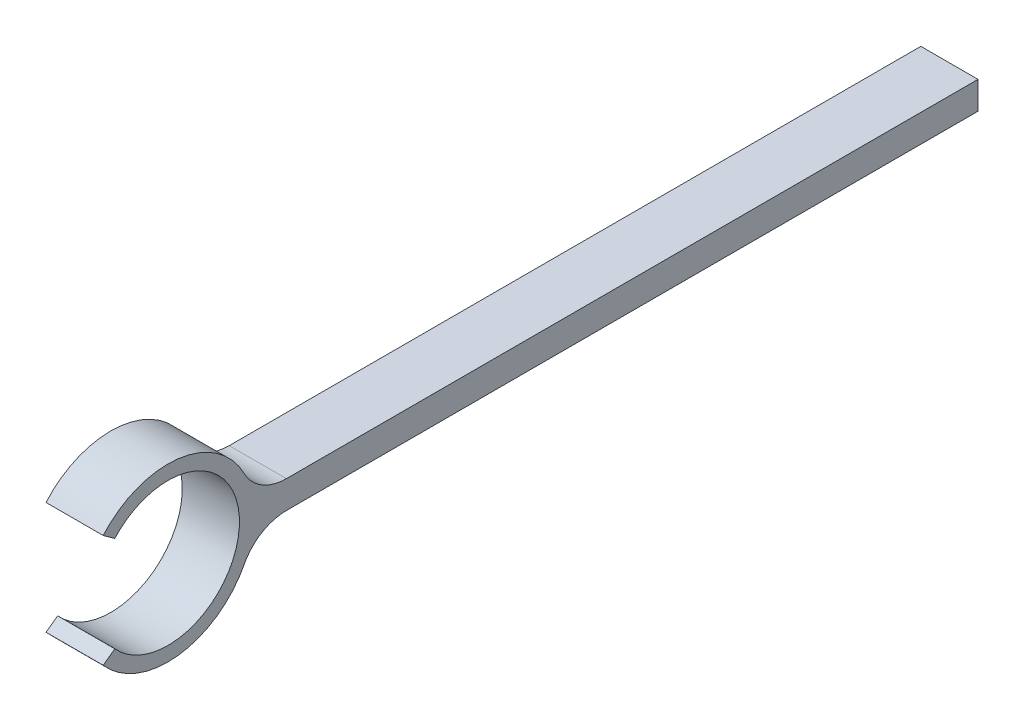
from build123d import *

# Parameters (mm, degrees)
BOSS_EXTRUDE1_DEPTH = 6
FILLET1_R           = 5


with BuildPart() as part:
    # Sketch1 → Boss-Extrude1 (new body)
    with BuildSketch(Plane(origin=(0, 0, 0), x_dir=(0, 0, -1), z_dir=(1, 0, 0))):
        with BuildLine():
            Line((-6.798778842, 5.897169343), (-5.575265079, 5.016614326))
            ThreePointArc((-5.575265079, 5.016614326), (7.5, 0), (-5.575265079, -5.016614326))
            Line((-5.575265079, -5.016614326), (-6.798778842, -5.897169343))
            ThreePointArc((-6.798778842, -5.897169343), (2.456239498, -8.658342077), (8.882657304, -1.44858525))
            Line((8.882657304, -1.44858525), (85, -1.44858525))
            Line((85, -1.44858525), (85, 1.44858525))
            Line((85, 1.44858525), (8.882657304, 1.44858525))
            ThreePointArc((8.882657304, 1.44858525), (2.456239498, 8.658342077), (-6.798778842, 5.897169343))
        make_face()
    extrude(amount=BOSS_EXTRUDE1_DEPTH)

    # Fillet1
    fillet1_edges = [part.edges().sort_by_distance(p)[0] for p in [
        (3, 1.44858525, -8.882657304),
        (3, -1.44858525, -8.882657304),
    ]]
    fillet(fillet1_edges, radius=FILLET1_R)


solid = part.part
